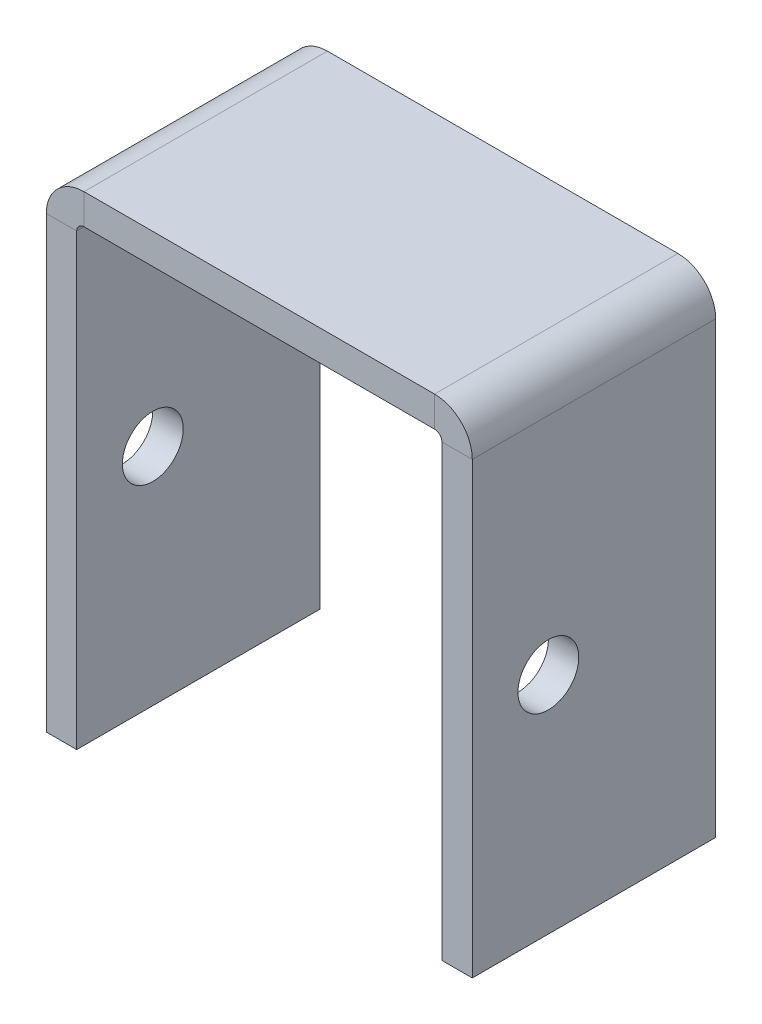
from build123d import *

# Parameters (mm, degrees)
BASE_FLANGE2_DEPTH      = 25.4
CUT_EXTRUDE1_DEPTH      = 61.989758362
CUT_EXTRUDE1_DEPTH_BACK = 61.989758362
SKETCH10_R              = 3.175


# Sheet-metal steps are written as plain solids
with BuildPart() as part:
    # Sketch1 → Base-Flange2 (new body)
    with BuildSketch(Plane.XY):
        with BuildLine():
            Line((-22.225, -50.8), (-22.225, -3.937))
            ThreePointArc((-22.225, -3.937), (-21.071879398, -1.153120602), (-18.288, 0))
            Line((-18.288, 0), (18.288, 0))
            ThreePointArc((18.288, 0), (21.071879398, -1.153120602), (22.225, -3.937))
            Line((22.225, -3.937), (22.225, -50.8))
            Line((22.225, -50.8), (19.05, -50.8))
            Line((19.05, -50.8), (19.05, -3.937))
            ThreePointArc((19.05, -3.937), (18.826815367, -3.398184633), (18.288, -3.175))
            Line((18.288, -3.175), (-18.288, -3.175))
            ThreePointArc((-18.288, -3.175), (-18.826815367, -3.398184633), (-19.05, -3.937))
            Line((-19.05, -3.937), (-19.05, -50.8))
            Line((-19.05, -50.8), (-22.225, -50.8))
        make_face()
    extrude(amount=BASE_FLANGE2_DEPTH)

    # Sketch10 → Cut-Extrude1 (cut, two sides: drawn at the far end of the back side and taken through both)
    with BuildSketch(Plane(origin=(0, 0, 0), x_dir=(0, 0, -1), z_dir=(1, 0, 0)).offset(-CUT_EXTRUDE1_DEPTH_BACK)):
        with Locations(Location((-17.4625, -27.3685, 0), (0, 0, 180))):
            Circle(SKETCH10_R)
    extrude(amount=CUT_EXTRUDE1_DEPTH + CUT_EXTRUDE1_DEPTH_BACK, mode=Mode.SUBTRACT)


solid = part.part
